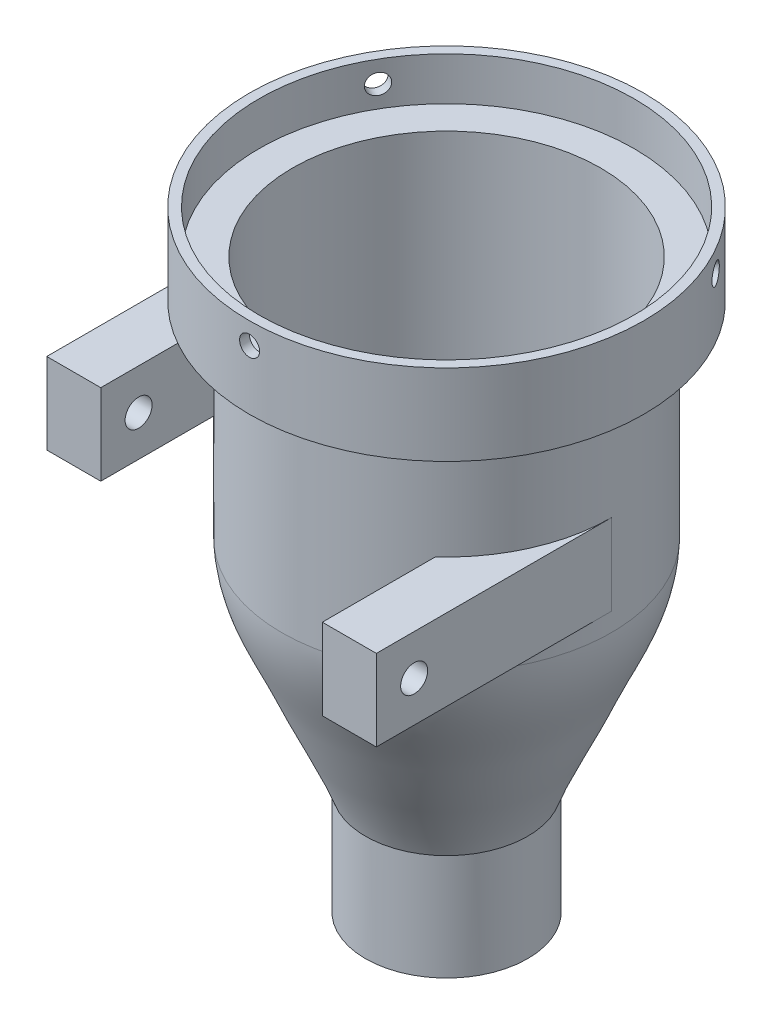
from build123d import *

# Parameters (mm, degrees)
SKETCH1_R                       = 12.6
SKETCH1_R_2                     = 11.1
BOSS_EXTRUDE1_DEPTH             = 0.001
SKETCH2_R                       = 30.5
SKETCH2_R_2                     = 28.5
BOSS_EXTRUDE2_DEPTH             = 45
SKETCH7_R                       = 36.5
SKETCH7_R_2                     = 30.5
BOSS_EXTRUDE3_DEPTH             = 7
BOSS_EXTRUDE4_REACH             = 110.118
SKETCH8_R                       = 15.011589035
SKETCH8_R_2                     = 12.6
SKETCH7_3_R                     = 36.5
SKETCH7_3_R_2                   = 34.7
BOSS_EXTRUDE5_DEPTH             = 8
SKETCH14_R                      = 1.85
CUT_EXTRUDE1_DEPTH              = 8
CIRPATTERN1_COUNT               = 3
BOSS_EXTRUDE6_REACH             = 133.416
SKETCH16_W                      = 10
SKETCH16_H                      = 15
BOSS_EXTRUDE6_DIRECTION_2_DEPTH = 7
SKETCH17_R                      = 2.5
CUT_EXTRUDE2_DEPTH              = 131.346653329
SKETCH8_5_R                     = 15.011589035
SKETCH8_5_R_2                   = 12.6
BOSS_EXTRUDE7_DEPTH             = 10


with BuildPart() as part:
    # Sketch1 → Boss-Extrude1 (new body)
    with BuildSketch(Plane(origin=(0, 0, 0), x_dir=(1, 0, 0), z_dir=(0, 1, 0))):
        Circle(SKETCH1_R)
        Circle(SKETCH1_R_2, mode=Mode.SUBTRACT)
    extrude(amount=-BOSS_EXTRUDE1_DEPTH)



with BuildPart() as body_2:
    # Sketch2 → Boss-Extrude2 (new body)
    with BuildSketch(Plane(origin=(0, 50, 0), x_dir=(1, 0, 0), z_dir=(0, 1, 0))):
        Circle(SKETCH2_R)
        Circle(SKETCH2_R_2, mode=Mode.SUBTRACT)
    extrude(amount=BOSS_EXTRUDE2_DEPTH)


with BuildPart() as part_1:
    add(part.part)

    add(body_2.part)  # Revolve2 merges body 2
    # Sketch6 → Revolve2 (revolve)
    with BuildSketch(Plane(origin=(0, 0, 0), x_dir=(0, 0, -1), z_dir=(1, 0, 0))):
        with BuildLine():
            Line((11.1, 0), (12.6, 0))
            add(Edge.make_bspline(
                [(12.6, 0), (14.219035257, 10.406719414), (19.248328345, 18.862718749), (26.086671293, 35.475812234), (30.18641801, 42.333036244), (30.5, 50)],
                knots=[0, 0, 0, 0, 0.476692395, 0.576692395, 1, 1, 1, 1], degree=3))
            Line((30.5, 50), (28.5, 50))
            add(Edge.make_bspline(
                [(11.1, 0), (11.515632478, 8.462663343), (16.341384341, 17.420081245), (23.859648418, 35.028645214), (27.060149287, 41.703867791), (28.5, 50)],
                knots=[0, 0, 0, 0, 0.530323892, 0.630323892, 1, 1, 1, 1], degree=3))
        make_face()
    revolve(axis=Axis((0, 0, 0), (0, 1, 0)))

    # Sketch8 → Boss-Extrude4 (add, up to next)
    with BuildSketch(Plane(origin=(0, 0, 0), x_dir=(1, 0, 0), z_dir=(0, 1, 0)), mode=Mode.PRIVATE) as boss_extrude4_sk1:
        Circle(SKETCH8_R)
        Circle(SKETCH8_R_2, mode=Mode.SUBTRACT)
    boss_extrude4_tool1 = extrude(boss_extrude4_sk1.sketch, amount=BOSS_EXTRUDE4_REACH, mode=Mode.PRIVATE) - part_1.part
    add(boss_extrude4_tool1.solids().sort_by_distance((-14.586997, 0, 0))[0])


with BuildPart() as body_2_2:
    # Sketch7 → Boss-Extrude3 (new body)
    with BuildSketch(Plane(origin=(0, 95, 0), x_dir=(1, 0, 0), z_dir=(0, 1, 0))):
        Circle(SKETCH7_R)
        Circle(SKETCH7_R_2, mode=Mode.SUBTRACT)
    extrude(amount=-BOSS_EXTRUDE3_DEPTH)


    add(part_1.part)  # Boss-Extrude5 merges part
    # Sketch7<3> → Boss-Extrude5 (add)
    with BuildSketch(Plane(origin=(0, 95, 0), x_dir=(1, 0, 0), z_dir=(0, 1, 0))):
        Circle(SKETCH7_3_R)
        Circle(SKETCH7_3_R_2, mode=Mode.SUBTRACT)
    extrude(amount=BOSS_EXTRUDE5_DEPTH)

    # Sketch14 → Cut-Extrude1 (cut)
    with BuildSketch(Plane.XY.offset(36.5)):
        with Locations((0, 99)):
            Circle(SKETCH14_R)
    cut_extrude1 = extrude(amount=-CUT_EXTRUDE1_DEPTH, mode=Mode.SUBTRACT)

    # CirPattern1: Cut-Extrude1 ×3 about axis
    cirpattern1_axis = Axis((0, 103, 0), (0, 1, 0))
    for i in range(1, CIRPATTERN1_COUNT):
        add(cut_extrude1.rotate(cirpattern1_axis, i * 360 / CIRPATTERN1_COUNT), mode=Mode.SUBTRACT)

    # Sketch16 → Boss-Extrude6 (add, up to next)
    with BuildSketch(Plane.XY.offset(36.5), mode=Mode.PRIVATE) as boss_extrude6_sk1:
        with Locations((-25.5, 78.026048254)):
            Rectangle(SKETCH16_W, SKETCH16_H)
    boss_extrude6_tool1 = extrude(boss_extrude6_sk1.sketch, amount=-BOSS_EXTRUDE6_REACH, mode=Mode.PRIVATE) - body_2_2.part
    # Sketch16 → Boss-Extrude6 (add, up to next)
    with BuildSketch(Plane.XY.offset(36.5), mode=Mode.PRIVATE) as boss_extrude6_sk2:
        with Locations((25.5, 60.936261958)):
            Rectangle(SKETCH16_W, SKETCH16_H)
    boss_extrude6_tool2 = extrude(boss_extrude6_sk2.sketch, amount=-BOSS_EXTRUDE6_REACH, mode=Mode.PRIVATE) - body_2_2.part
    add(boss_extrude6_tool1.solids().sort_by_distance((-25.5, 78.026048, 36.5))[0])
    add(boss_extrude6_tool2.solids().sort_by_distance((25.5, 60.936262, 36.5))[0])

    # Sketch16 → Boss-Extrude6 direction 2 (add)
    with BuildSketch(Plane.XY.offset(36.5)):
        with Locations((-25.5, 78.026048254)):
            Rectangle(SKETCH16_W, SKETCH16_H)
        with Locations((25.5, 60.936261958)):
            Rectangle(SKETCH16_W, SKETCH16_H)
    extrude(amount=BOSS_EXTRUDE6_DIRECTION_2_DEPTH)

    # Sketch17 → Cut-Extrude2 (cut, through all)
    with BuildSketch(Plane.ZY.offset(30.5)):
        with Locations((36.5, 78.026048254)):
            Circle(SKETCH17_R)
        with Locations((36.5, 60.936261958)):
            Circle(SKETCH17_R)
    extrude(amount=-CUT_EXTRUDE2_DEPTH, mode=Mode.SUBTRACT)

    # Sketch8<5> → Boss-Extrude7 (add)
    with BuildSketch(Plane(origin=(0, 0, 0), x_dir=(1, 0, 0), z_dir=(0, 1, 0))):
        Circle(SKETCH8_5_R)
        Circle(SKETCH8_5_R_2, mode=Mode.SUBTRACT)
    extrude(amount=-BOSS_EXTRUDE7_DEPTH)


solid = body_2_2.part
